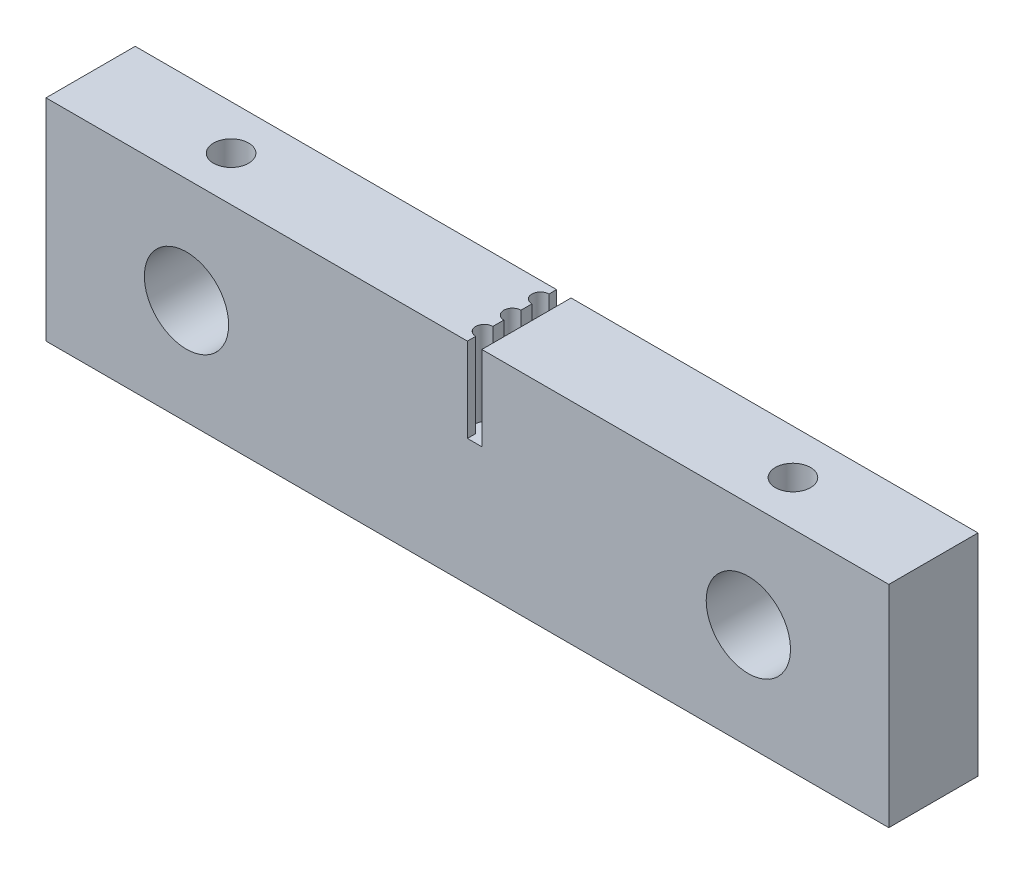
from build123d import *

# Parameters (mm, degrees)
SKETCH1_W             = 60
SKETCH1_H             = 15
SKETCH1_R             = 3
BOSS_EXTRUDE1_DEPTH   = 6.35
M3_TAPPED_HOLE1_D     = 2.5
M3_TAPPED_HOLE1_DEPTH = 8.5
M3_TAPPED_HOLE1_TIP   = 0.751075774
CUT_EXTRUDE1_DEPTH    = 6


with BuildPart() as part:
    # Sketch1 → Boss-Extrude1 (new body)
    with BuildSketch(Plane.XY):
        with Locations((30, 7.5)):
            Rectangle(SKETCH1_W, SKETCH1_H)
        with Locations((10, 7.5)):
            Circle(SKETCH1_R, mode=Mode.SUBTRACT)
        with Locations((50, 7.5)):
            Circle(SKETCH1_R, mode=Mode.SUBTRACT)
    extrude(amount=BOSS_EXTRUDE1_DEPTH)

    # M3 Tapped Hole1
    with Locations(Plane(origin=(0, 15, 0), x_dir=(-1, 0, 0), z_dir=(0, 1, 0))):
        with Locations((-10, 3.175), (-50, 3.175)):
            Hole(M3_TAPPED_HOLE1_D / 2, depth=M3_TAPPED_HOLE1_DEPTH)
            with Locations((0, 0, -(M3_TAPPED_HOLE1_DEPTH + M3_TAPPED_HOLE1_TIP / 2))):  # 118° drill point
                Cone(0, M3_TAPPED_HOLE1_D / 2, M3_TAPPED_HOLE1_TIP, mode=Mode.SUBTRACT)

    # Sketch5 → Cut-Extrude1 (cut)
    with BuildSketch(Plane(origin=(0, 15, 0), x_dir=(1, 0, 0), z_dir=(0, 1, 0))):
        with BuildLine():
            Line((31.03, -6.35), (31.03, 0))
            Line((31.03, 0), (30, 0))
            Line((30, 0), (30, -0.53745462))
            ThreePointArc((30, -0.53745462), (29.39, -1.14745462), (30, -1.75745462))
            Line((30, -1.75745462), (30, -2.53745462))
            ThreePointArc((30, -2.53745462), (29.39, -3.14745462), (30, -3.75745462))
            Line((30, -3.75745462), (30, -4.53745462))
            ThreePointArc((30, -4.53745462), (29.39, -5.14745462), (30, -5.75745462))
            Line((30, -5.75745462), (30, -6.35))
            Line((30, -6.35), (31.03, -6.35))
        make_face()
    extrude(amount=-CUT_EXTRUDE1_DEPTH, mode=Mode.SUBTRACT)


solid = part.part
